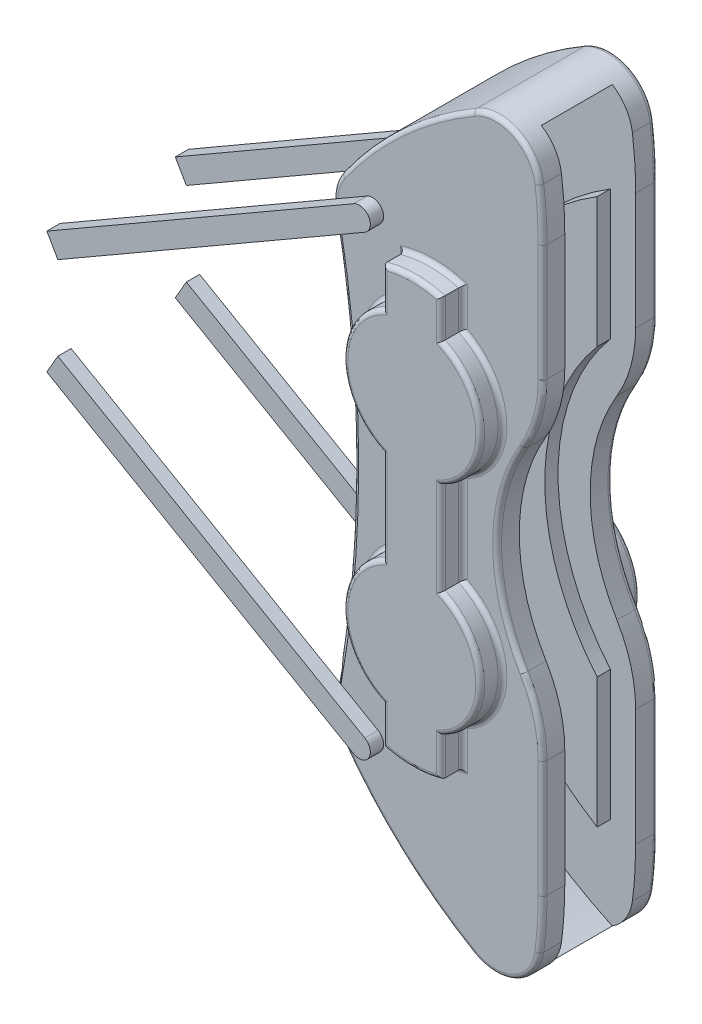
from build123d import *

# Parameters (mm, degrees)
Y_KSEKLIK_EKSTR_ZYON1_START  = 13
Y_KSEKLIK_EKSTR_ZYON1_DEPTH  = 5
Y_KSEKLIK_EKSTR_ZYON2_START  = -13
Y_KSEKLIK_EKSTR_ZYON2_DEPTH  = 5
Y_KSEKLIK_EKSTR_ZYON3_DEPTH  = 16
KES_EKSTR_ZYON1_DEPTH        = 18
PADD1_START                  = 10
PADD1_DEPTH                  = 3
PADD2_START                  = -13
PADD2_DEPTH                  = 3
KES_EKSTR_ZYON2_DEPTH        = 21.5
RADYUS2_START                = -19
RADYUS2_DEPTH                = 38
RADYUS3_R                    = 30
Y_KSEKLIK_EKSTR_ZYON7_START  = 18
Y_KSEKLIK_EKSTR_ZYON7_DEPTH  = 5
Y_KSEKLIK_EKSTR_ZYON8_START  = -23
Y_KSEKLIK_EKSTR_ZYON8_DEPTH  = 5
RADYUS6_R                    = 1
IZIM8_W                      = 48.407798882
IZIM8_H                      = 204.720031617
KES_EKSTR_ZYON3_DEPTH        = 115
Y_KSEKLIK_EKSTR_ZYON9_START  = -16
Y_KSEKLIK_EKSTR_ZYON9_DEPTH  = 3
Y_KSEKLIK_EKSTR_ZYON10_START = 13
Y_KSEKLIK_EKSTR_ZYON10_DEPTH = 3


with BuildPart() as part:
    # Çizim1 → Yükseklik-Ekstrüzyon1 (new body)
    with BuildSketch(Plane.XY.offset(Y_KSEKLIK_EKSTR_ZYON1_START)):
        with BuildLine():
            Line((-32.481245151, 27.803557574), (-32.481245151, 89.803557574))
            ThreePointArc((-32.481245151, 89.803557574), (-95.497173987, 0), (-32.481245151, -89.803557574))
            Line((-32.481245151, -89.803557574), (-32.481245151, -27.803557574))
            ThreePointArc((-32.481245151, -27.803557574), (-42.755924739, 0), (-32.481245151, 27.803557574))
        make_face()
    extrude(amount=Y_KSEKLIK_EKSTR_ZYON1_DEPTH)



with BuildPart() as body_2:
    # Çizim1<2> → Yükseklik-Ekstrüzyon2 (new body)
    with BuildSketch(Plane.XY.offset(Y_KSEKLIK_EKSTR_ZYON2_START)):
        with BuildLine():
            Line((-32.481245151, 27.803557574), (-32.481245151, 89.803557574))
            ThreePointArc((-32.481245151, 89.803557574), (-95.497173987, 0), (-32.481245151, -89.803557574))
            Line((-32.481245151, -89.803557574), (-32.481245151, -27.803557574))
            ThreePointArc((-32.481245151, -27.803557574), (-42.755924739, 0), (-32.481245151, 27.803557574))
        make_face()
    extrude(amount=-Y_KSEKLIK_EKSTR_ZYON2_DEPTH)


with BuildPart() as part_1:
    add(part.part)

    add(body_2.part)  # Yükseklik-Ekstrüzyon3 merges body 2
    # Çizim2 → Yükseklik-Ekstrüzyon3 (add, symmetric)
    with BuildSketch(Plane.XY):
        with BuildLine():
            Line((-32.481245151, 89.803557574), (-32.481245151, 84.470223827))
            ThreePointArc((-32.481245151, 84.470223827), (-90.5, 0), (-32.481245151, -84.470223827))
            Line((-32.481245151, -84.470223827), (-32.481245151, -89.803557574))
            ThreePointArc((-32.481245151, -89.803557574), (-95.497173987, 0), (-32.481245151, 89.803557574))
        make_face()
    extrude(amount=Y_KSEKLIK_EKSTR_ZYON3_DEPTH, both=True)

    # Çizim3 → Kes-Ekstrüzyon1 (cut, symmetric)
    with BuildSketch(Plane.XY):
        with BuildLine():
            ThreePointArc((-80.989860836, 54.39716891), (-75, 0), (-80.989860836, -54.39716891))
            ThreePointArc((-80.989860836, -54.39716891), (-97.562336707, 0), (-80.989860836, 54.39716891))
        make_face()
    extrude(amount=KES_EKSTR_ZYON1_DEPTH, both=True, mode=Mode.SUBTRACT)

    # Çizim4 → padd1 (add)
    with BuildSketch(Plane.XY.offset(PADD1_START)):
        with BuildLine():
            Line((-38.177323214, 61.633935394), (-38.177323214, 32.287644575))
            ThreePointArc((-38.177323214, 32.287644575), (-50, 0), (-38.177323214, -32.287644575))
            Line((-38.177323214, -32.287644575), (-38.177323214, -61.633935394))
            ThreePointArc((-38.177323214, -61.633935394), (-72.5, 0), (-38.177323214, 61.633935394))
        make_face()
    extrude(amount=PADD1_DEPTH)

    # Çizim4<2> → padd2 (add)
    with BuildSketch(Plane.XY.offset(PADD2_START)):
        with BuildLine():
            Line((-38.177323214, 61.633935394), (-38.177323214, 32.287644575))
            ThreePointArc((-38.177323214, 32.287644575), (-50, 0), (-38.177323214, -32.287644575))
            Line((-38.177323214, -32.287644575), (-38.177323214, -61.633935394))
            ThreePointArc((-38.177323214, -61.633935394), (-72.5, 0), (-38.177323214, 61.633935394))
        make_face()
    extrude(amount=PADD2_DEPTH)

    # Çizim5 → Kes-Ekstrüzyon2 (cut, symmetric)
    with BuildSketch(Plane.XY):
        with BuildLine():
            Line((-32.481245151, 89.803557574), (-32.481245151, 63.63730381))
            add(Edge.make_bspline(
                [(-32.481245151, 63.63730381), (-32.481245151, 76.638966843), (-36.096064659, 88.412580302)],
                knots=[5.652168505, 5.652168505, 5.652168505, 5.921489357, 5.921489357, 5.921489357], degree=2, weights=[1, 0.990946977, 1]))
            ThreePointArc((-36.096064659, 88.412580302), (-34.295707598, 89.126397211), (-32.481245151, 89.803557574))
        make_face()
        with BuildLine():
            Line((-32.481245151, -89.803557574), (-32.481245151, -63.63730381))
            add(Edge.make_bspline(
                [(-36.096064659, -88.412580302), (-32.481245151, -76.638966843), (-32.481245151, -63.63730381)],
                knots=[3.503288604, 3.503288604, 3.503288604, 3.772609456, 3.772609456, 3.772609456], degree=2, weights=[1, 0.990946977, 1]))
            ThreePointArc((-36.096064659, -88.412580302), (-34.295707598, -89.126397211), (-32.481245151, -89.803557574))
        make_face()
    extrude(amount=KES_EKSTR_ZYON2_DEPTH, both=True, mode=Mode.SUBTRACT)

    # Radyus2: read off the stored shape, not the designer's step
    # Radyus2 outline → Radyus2 (cut)
    with BuildSketch(Plane.XY.offset(RADYUS2_START)):
        with BuildLine():
            ThreePointArc((-80.376477292, 51.568712779), (-79.961623842, 49.560006151), (-79.563264438, 47.547963536))
            ThreePointArc((-79.563264438, 47.547963536), (-79.52045673, 51.560803288), (-77.903467575, 55.233685187))
            ThreePointArc((-77.903467575, 55.233685187), (-79.161185201, 53.415512701), (-80.376477292, 51.568712779))
        make_face()
        with BuildLine():
            ThreePointArc((-33.221104957, -75.11800143), (-38.734635009, -82.79680046), (-48.181525497, -82.451505991))
            ThreePointArc((-48.181525497, -82.451505991), (-42.244072393, -85.645482001), (-36.096064659, -88.412580302))
            add(Edge.make_bspline(
                [(-33.221104957, -75.11800143), (-34.121096657, -81.980029574), (-36.096064659, -88.412580302)],
                knots=[2.632145614, 2.632145614, 2.632145614, 2.779896703, 2.779896703, 2.779896703], degree=2, weights=[0.995516265, 0.995033456, 1]))
        make_face()
        with BuildLine():
            ThreePointArc((-77.903467575, -55.233685187), (-79.52045673, -51.560803288), (-79.563264438, -47.547963536))
            ThreePointArc((-79.563264438, -47.547963536), (-79.961623842, -49.560006151), (-80.376477292, -51.568712779))
            ThreePointArc((-80.376477292, -51.568712779), (-79.161185201, -53.415512701), (-77.903467575, -55.233685187))
        make_face()
        with BuildLine():
            ThreePointArc((-36.096064659, 88.412580302), (-42.244072393, 85.645482001), (-48.181525497, 82.451505992))
            ThreePointArc((-48.181525497, 82.451505992), (-38.734635009, 82.79680046), (-33.221104957, 75.11800143))
            add(Edge.make_bspline(
                [(-36.096064659, 88.412580302), (-34.121096657, 81.980029574), (-33.221104957, 75.11800143)],
                knots=[3.503288604, 3.503288604, 3.503288604, 3.651039693, 3.651039693, 3.651039693], degree=2, weights=[1, 0.995033456, 0.995516265]))
        make_face()
    extrude(amount=RADYUS2_DEPTH, mode=Mode.SUBTRACT)

    # Radyus3
    radyus3_edges = [part_1.edges().sort_by_distance(p)[0] for p in [
        (-32.481245151, -27.803557574, -15.5),
        (-32.481245151, 27.803557574, -15.5),
        (-32.481245151, 27.803557574, 15.5),
        (-32.481245151, -27.803557574, 15.5),
    ]]
    fillet(radyus3_edges, radius=RADYUS3_R)

    # Çizim6 → Yükseklik-Ekstrüzyon7 (add)
    with BuildSketch(Plane.XY.offset(Y_KSEKLIK_EKSTR_ZYON7_START)):
        with BuildLine():
            Line((-63.566020165, -10.460277448), (-63.566020165, 10.460277448))
            ThreePointArc((-63.566020165, 10.460277448), (-72.467711777, 24.458150805), (-63.566020165, 38.456024162))
            Line((-63.566020165, 38.456024162), (-63.566020165, 47.133546158))
            ThreePointArc((-63.566020165, 47.133546158), (-57.011066901, 48.061984534), (-50.456113638, 47.133546158))
            Line((-50.456113638, 47.133546158), (-50.456113638, 38.456024162))
            ThreePointArc((-50.456113638, 38.456024162), (-41.554422026, 24.458150805), (-50.456113638, 10.460277448))
            Line((-50.456113638, 10.460277448), (-50.456113638, -10.460277448))
            ThreePointArc((-50.456113638, -10.460277448), (-41.554422026, -24.458150805), (-50.456113638, -38.456024162))
            Line((-50.456113638, -38.456024162), (-50.456113638, -47.133546158))
            ThreePointArc((-50.456113638, -47.133546158), (-57.011066901, -48.061984534), (-63.566020165, -47.133546158))
            Line((-63.566020165, -47.133546158), (-63.566020165, -38.456024162))
            ThreePointArc((-63.566020165, -38.456024162), (-72.467711777, -24.458150805), (-63.566020165, -10.460277448))
        make_face()
    extrude(amount=Y_KSEKLIK_EKSTR_ZYON7_DEPTH)

    # Çizim6<2> → Yükseklik-Ekstrüzyon8 (add)
    with BuildSketch(Plane.XY.offset(Y_KSEKLIK_EKSTR_ZYON8_START)):
        with BuildLine():
            Line((-63.566020165, -10.460277448), (-63.566020165, 10.460277448))
            ThreePointArc((-63.566020165, 10.460277448), (-72.467711777, 24.458150805), (-63.566020165, 38.456024162))
            Line((-63.566020165, 38.456024162), (-63.566020165, 47.133546158))
            ThreePointArc((-63.566020165, 47.133546158), (-57.011066901, 48.061984534), (-50.456113638, 47.133546158))
            Line((-50.456113638, 47.133546158), (-50.456113638, 38.456024162))
            ThreePointArc((-50.456113638, 38.456024162), (-41.554422026, 24.458150805), (-50.456113638, 10.460277448))
            Line((-50.456113638, 10.460277448), (-50.456113638, -10.460277448))
            ThreePointArc((-50.456113638, -10.460277448), (-41.554422026, -24.458150805), (-50.456113638, -38.456024162))
            Line((-50.456113638, -38.456024162), (-50.456113638, -47.133546158))
            ThreePointArc((-50.456113638, -47.133546158), (-57.011066901, -48.061984534), (-63.566020165, -47.133546158))
            Line((-63.566020165, -47.133546158), (-63.566020165, -38.456024162))
            ThreePointArc((-63.566020165, -38.456024162), (-72.467711777, -24.458150805), (-63.566020165, -10.460277448))
        make_face()
    extrude(amount=Y_KSEKLIK_EKSTR_ZYON8_DEPTH)

    # Radyus6
    radyus6_edges = [part_1.edges().sort_by_distance(p)[0] for p in [
        (-32.481245151, -50.456775396, -18),
        (-32.66397385, -69.389756604, -18),
        (-32.481245151, -50.456775396, 18),
        (-32.66397385, -69.389756604, 18),
        (-64.494641729, 70.428342503, 18),
        (-64.494641729, 70.428342503, -18),
        (-32.66397385, 69.389756604, 18),
        (-75, 0, 18),
        (-64.49464173, -70.428342503, 18),
        (-38.734635009, 82.79680046, 18),
        (-38.734635009, -82.79680046, 18),
        (-79.52045673, -51.560803288, 18),
        (-79.52045673, 51.560803288, 18),
        (-75, 0, -18),
        (-32.66397385, 69.389756604, -18),
        (-64.49464173, -70.428342503, -18),
        (-38.734635009, 82.79680046, -18),
        (-38.734635009, -82.79680046, -18),
        (-79.52045673, -51.560803288, -18),
        (-79.52045673, 51.560803288, -18),
        (-42.755924739, 0, 18),
        (-32.481245151, 50.456775396, 18),
        (-33.559791931, 29.304450218, 18),
        (-33.559791931, -29.304450218, 18),
        (-42.755924739, 0, -18),
        (-32.481245151, 50.456775396, -18),
        (-33.559791931, 29.304450218, -18),
        (-33.559791931, -29.304450218, -18),
        (-57.011066901, 48.061984534, 18),
        (-63.566020165, 42.79478516, 18),
        (-72.467711777, 24.458150805, 18),
        (-63.566020165, 0, 18),
        (-72.467711777, -24.458150805, 18),
        (-63.566020165, -42.79478516, 18),
        (-57.011066901, -48.061984534, 18),
        (-50.456113638, -42.79478516, 18),
        (-41.554422026, -24.458150805, 18),
        (-50.456113638, 0, 18),
        (-41.554422026, 24.458150805, 18),
        (-50.456113638, 42.79478516, 18),
        (-57.011066901, 48.061984534, 23),
        (-63.566020165, 42.79478516, 23),
        (-72.467711777, 24.458150805, 23),
        (-63.566020165, 0, 23),
        (-72.467711777, -24.458150805, 23),
        (-63.566020165, -42.79478516, 23),
        (-57.011066901, -48.061984534, 23),
        (-50.456113638, -42.79478516, 23),
        (-41.554422026, -24.458150805, 23),
        (-50.456113638, 0, 23),
        (-41.554422026, 24.458150805, 23),
        (-50.456113638, 42.79478516, 23),
        (-57.011066901, 48.061984534, -23),
        (-50.456113638, 42.79478516, -23),
        (-41.554422026, 24.458150805, -23),
        (-50.456113638, 0, -23),
        (-41.554422026, -24.458150805, -23),
        (-50.456113638, -42.79478516, -23),
        (-57.011066901, -48.061984534, -23),
        (-63.566020165, -42.79478516, -23),
        (-72.467711777, -24.458150805, -23),
        (-63.566020165, 0, -23),
        (-72.467711777, 24.458150805, -23),
        (-63.566020165, 42.79478516, -23),
        (-57.011066901, 48.061984534, -18),
        (-63.566020165, 42.79478516, -18),
        (-72.467711777, 24.458150805, -18),
        (-63.566020165, 0, -18),
        (-72.467711777, -24.458150805, -18),
        (-63.566020165, -42.79478516, -18),
        (-57.011066901, -48.061984534, -18),
        (-50.456113638, -42.79478516, -18),
        (-41.554422026, -24.458150805, -18),
        (-50.456113638, 0, -18),
        (-41.554422026, 24.458150805, -18),
        (-50.456113638, 42.79478516, -18),
    ]]
    fillet(radyus6_edges, radius=RADYUS6_R)

    # Çizim8 → Kes-Ekstrüzyon3 (cut)
    with BuildSketch(Plane(origin=(0, 0, 0), x_dir=(0, 0, -1), z_dir=(1, 0, 0))):
        with Locations((19.203899441, -5.044671128)):
            Rectangle(IZIM8_W, IZIM8_H)
    extrude(amount=-KES_EKSTR_ZYON3_DEPTH, mode=Mode.SUBTRACT)

    # Aynalama3: part across plane


with BuildPart() as part_2:
    add(part_1.part)
    add(part_1.part.mirror(Plane(origin=(0, 0, 5), x_dir=(1, 0, 0), z_dir=(0, 0, -1))))

    # Çizim9 → Yükseklik-Ekstrüzyon9 (add)
    with BuildSketch(Plane(origin=(0, 0, 5), x_dir=(-1, 0, 0), z_dir=(0, 0, -1)).offset(Y_KSEKLIK_EKSTR_ZYON9_START)):
        with BuildLine():
            Line((138.900987396, 9.436472349), (69.618955093, 49.436472349))
            ThreePointArc((69.618955093, 49.436472349), (68.703891583, 52.851535859), (72.118955093, 53.766599368))
            Line((72.118955093, 53.766599368), (141.400987396, 13.766599368))
            Line((141.400987396, 13.766599368), (138.900987396, 9.436472349))
        make_face()
        with BuildLine():
            Line((138.900987396, -9.436472349), (141.400987396, -13.766599368))
            Line((141.400987396, -13.766599368), (72.118955093, -53.766599368))
            ThreePointArc((72.118955093, -53.766599368), (68.703891583, -52.851535859), (69.618955093, -49.436472349))
            Line((69.618955093, -49.436472349), (138.900987396, -9.436472349))
        make_face()
    extrude(amount=Y_KSEKLIK_EKSTR_ZYON9_DEPTH)

    # Çizim9<2> → Yükseklik-Ekstrüzyon10 (add)
    with BuildSketch(Plane(origin=(0, 0, 5), x_dir=(-1, 0, 0), z_dir=(0, 0, -1)).offset(Y_KSEKLIK_EKSTR_ZYON10_START)):
        with BuildLine():
            Line((138.900987396, 9.436472349), (69.618955093, 49.436472349))
            ThreePointArc((69.618955093, 49.436472349), (68.703891583, 52.851535859), (72.118955093, 53.766599368))
            Line((72.118955093, 53.766599368), (141.400987396, 13.766599368))
            Line((141.400987396, 13.766599368), (138.900987396, 9.436472349))
        make_face()
        with BuildLine():
            Line((138.900987396, -9.436472349), (141.400987396, -13.766599368))
            Line((141.400987396, -13.766599368), (72.118955093, -53.766599368))
            ThreePointArc((72.118955093, -53.766599368), (68.703891583, -52.851535859), (69.618955093, -49.436472349))
            Line((69.618955093, -49.436472349), (138.900987396, -9.436472349))
        make_face()
    extrude(amount=Y_KSEKLIK_EKSTR_ZYON10_DEPTH)


solid = part_2.part
